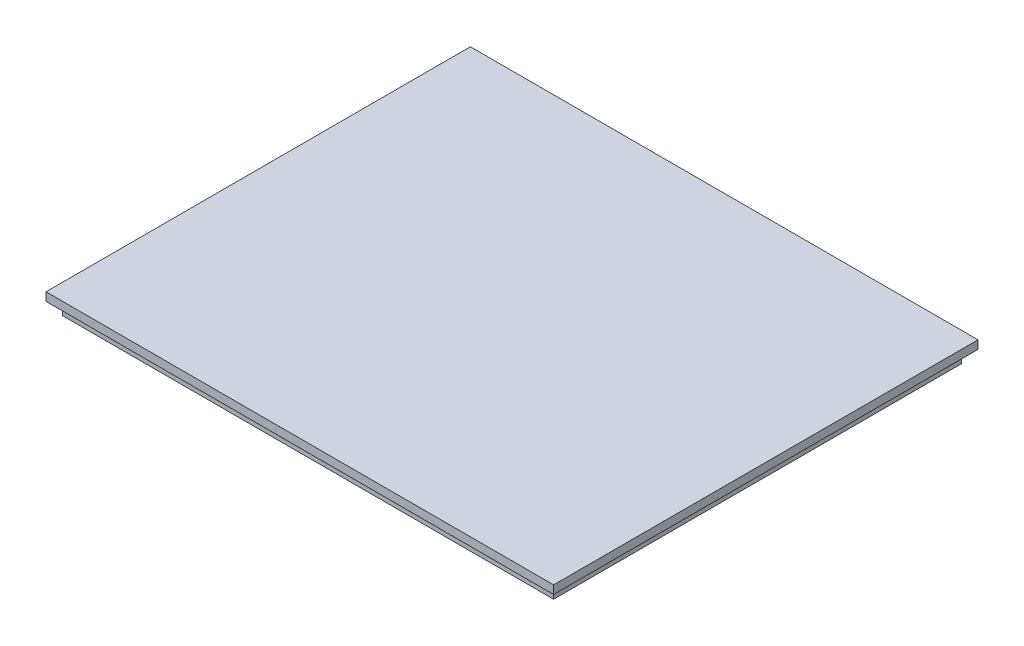
from build123d import *

# Parameters (mm, degrees)
STOCK_BOX_1_START         = 83.223281248
STOCK_BOX_1_OUTLINE_W     = 122
STOCK_BOX_1_OUTLINE_H     = 102
STOCK_BOX_1_DEPTH         = 5
STOCK_BOX_1_START_2       = 80.223281248
STOCK_BOX_1_2_OUTLINE_W   = 118
STOCK_BOX_1_2_OUTLINE_H   = 98
STOCK_BOX_1_2_OUTLINE_W_2 = 114
STOCK_BOX_1_2_OUTLINE_H_2 = 94
STOCK_BOX_1_2_DEPTH       = 3
CUT_EXTRUDE2_REACH        = 168.26
SKETCH2_W                 = 19
SKETCH2_H                 = 3
SKETCH2_W_2               = 11
SKETCH3_W                 = 122
SKETCH3_H                 = 102
BOSS_EXTRUDE1_DEPTH       = 3
SKETCH4_W                 = 122
SKETCH4_H                 = 102
CUT_EXTRUDE3_DEPTH        = 3


# Read off the part's stored shape, not the designer's step: Stock-Box-1
with BuildPart() as part:
    # Stock-Box-1 outline → Stock-Box-1 (new body)
    with BuildSketch(Plane(origin=(0, 0, 0), x_dir=(1, 0, 0), z_dir=(0, 1, 0)).offset(STOCK_BOX_1_START)):
        with Locations((6.476673428, -22.886409736)):
            Rectangle(STOCK_BOX_1_OUTLINE_W, STOCK_BOX_1_OUTLINE_H)
    extrude(amount=STOCK_BOX_1_DEPTH)

    # Stock-Box-1 2 outline → Stock-Box-1 2 (add)
    with BuildSketch(Plane(origin=(0, 0, 0), x_dir=(1, 0, 0), z_dir=(0, 1, 0)).offset(STOCK_BOX_1_START_2)):
        with Locations((6.476673428, -22.886409736)):
            Rectangle(STOCK_BOX_1_2_OUTLINE_W, STOCK_BOX_1_2_OUTLINE_H)
        with Locations((6.476673428, -22.886409736)):
            Rectangle(STOCK_BOX_1_2_OUTLINE_W_2, STOCK_BOX_1_2_OUTLINE_H_2, mode=Mode.SUBTRACT)
    extrude(amount=STOCK_BOX_1_2_DEPTH)

    # Sketch2 → Cut-Extrude2 (cut, up to next)
    with BuildSketch(Plane.ZY.offset(52.523326572), mode=Mode.PRIVATE) as cut_extrude2_sk1:
        with Locations((-3.613590264, 81.723281248)):
            Rectangle(SKETCH2_W, SKETCH2_H)
    cut_extrude2_tool1 = extrude(cut_extrude2_sk1.sketch, amount=-CUT_EXTRUDE2_REACH, mode=Mode.PRIVATE) & part.part
    # Sketch2 → Cut-Extrude2 (cut, up to next)
    with BuildSketch(Plane.ZY.offset(52.523326572), mode=Mode.PRIVATE) as cut_extrude2_sk2:
        with Locations((21.386409736, 81.723281248)):
            Rectangle(SKETCH2_W_2, SKETCH2_H)
    cut_extrude2_tool2 = extrude(cut_extrude2_sk2.sketch, amount=-CUT_EXTRUDE2_REACH, mode=Mode.PRIVATE) & part.part
    add(cut_extrude2_tool1.solids().sort_by_distance((-52.523327, 81.723281, -3.61359))[0], mode=Mode.SUBTRACT)
    add(cut_extrude2_tool2.solids().sort_by_distance((-52.523327, 81.723281, 21.38641))[0], mode=Mode.SUBTRACT)

    # Sketch3 → Boss-Extrude1 (add)
    with BuildSketch(Plane(origin=(0, 88.223281248, 0), x_dir=(1, 0, 0), z_dir=(0, 1, 0))):
        with Locations((6.476673428, -22.886409736)):
            Rectangle(SKETCH3_W, SKETCH3_H)
    extrude(amount=-BOSS_EXTRUDE1_DEPTH)

    # Sketch4 → Cut-Extrude3 (cut)
    with BuildSketch(Plane(origin=(0, 88.223281248, 0), x_dir=(1, 0, 0), z_dir=(0, 1, 0))):
        with Locations((6.476673428, -22.886409736)):
            Rectangle(SKETCH4_W, SKETCH4_H)
    extrude(amount=-CUT_EXTRUDE3_DEPTH, mode=Mode.SUBTRACT)


solid = part.part
